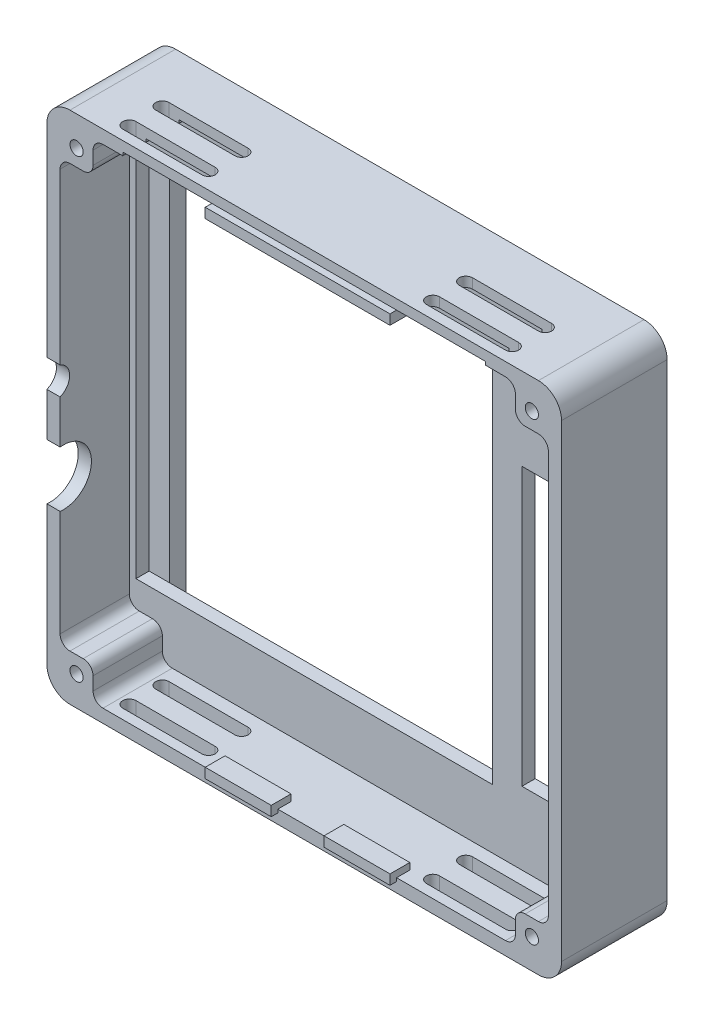
from build123d import *

# Parameters (mm, degrees)
SKETCH_1_W           = 78
SKETCH_1_H           = 78
EXTRUDE_1_DEPTH      = 5.5
SKETCH_2_W           = 78
SKETCH_2_H           = 78
EXTRUDE_2_DEPTH      = 10.5
FILLET_1_R           = 1.5
FILLET_2_R           = 3.5
CUT_EXTRUDE_1_DEPTH  = 1
CUT_EXTRUDE_2_DEPTH  = 2.5
SKETCH_5_R           = 1
CUT_EXTRUDE_3_DEPTH  = 58.15767665
SKETCH_6_W           = 55
SKETCH_6_H           = 2
SKETCH_6_W_2         = 54
SKETCH_6_H_2         = 58
SKETCH_6_W_3         = 12.5
SKETCH_6_H_3         = 42
CUT_EXTRUDE_4_DEPTH  = 57.553072419
EXTRUDE_3_DEPTH      = 1
EXTRUDE_3_DEPTH_BACK = 2
SKETCH_7_W           = 10
SKETCH_7_H           = 1.5
SKETCH_7_W_2         = 28
SKETCH_8_R           = 4.25
SKETCH_8_R_2         = 2.247220505
CUT_EXTRUDE_5_DEPTH  = 10
CUT_EXTRUDE_6_DEPTH  = 89.848185125


with BuildPart() as part:
    # 草图1 → 凸台-拉伸1 (new body)
    with BuildSketch(Plane.XY):
        Rectangle(SKETCH_1_W, SKETCH_1_H)
    extrude(amount=EXTRUDE_1_DEPTH)

    # 草图2 → 凸台-拉伸2 (add)
    with BuildSketch(Plane.XY.offset(5.5)):
        Rectangle(SKETCH_2_W, SKETCH_2_H)
        Polygon((-32, 37), (32, 37), (32, 32), (37, 32), (37, -32), (32, -32), (32, -37), (-32, -37), (-32, -32), (-37, -32), (-37, 32), (-32, 32), align=None, mode=Mode.SUBTRACT)
    extrude(amount=EXTRUDE_2_DEPTH)

    # 圆角1
    fillet_1_edges = [part.edges().sort_by_distance(p)[0] for p in [
        (37, 32, 10.75),
        (32, 32, 10.75),
        (32, 37, 10.75),
        (37, -32, 10.75),
        (32, -32, 10.75),
        (32, -37, 10.75),
        (-32, -37, 10.75),
        (-32, -32, 10.75),
        (-37, -32, 10.75),
        (-37, 32, 10.75),
        (-32, 37, 10.75),
        (-32, 32, 10.75),
    ]]
    fillet(fillet_1_edges, radius=FILLET_1_R)

    # 圆角2
    fillet_2_edges = [part.edges().sort_by_distance(p)[0] for p in [
        (-39, 39, 8),
        (39, 39, 8),
        (39, -39, 8),
        (-39, -39, 8),
    ]]
    fillet(fillet_2_edges, radius=FILLET_2_R)

    # 草图3 → 切除-拉伸1 (cut)
    with BuildSketch(Plane(origin=(0, 0, 0), x_dir=(-1, 0, 0), z_dir=(0, 0, -1))):
        with BuildLine():
            Line((37.5, -35.5), (37.5, 35.5))
            ThreePointArc((37.5, 35.5), (36.914213562, 36.914213562), (35.5, 37.5))
            Line((35.5, 37.5), (-35.5, 37.5))
            ThreePointArc((-35.5, 37.5), (-36.914213562, 36.914213562), (-37.5, 35.5))
            Line((-37.5, 35.5), (-37.5, -35.5))
            ThreePointArc((-37.5, -35.5), (-36.914213562, -36.914213562), (-35.5, -37.5))
            Line((-35.5, -37.5), (35.5, -37.5))
            ThreePointArc((35.5, -37.5), (36.914213562, -36.914213562), (37.5, -35.5))
        make_face()
    extrude(amount=-CUT_EXTRUDE_1_DEPTH, mode=Mode.SUBTRACT)

    # 草图4 → 切除-拉伸2 (cut)
    with BuildSketch(Plane(origin=(0, 0, 1), x_dir=(-1, 0, 0), z_dir=(0, 0, -1))):
        Polygon((27.5, 37.5), (-27.5, 37.5), (-27.5, 36.85), (-32.95, 36.85), (-32.95, -33), (32.95, -33), (32.95, 36.85), (27.5, 36.85), align=None)
    extrude(amount=-CUT_EXTRUDE_2_DEPTH, mode=Mode.SUBTRACT)

    # 草图5 → 切除-拉伸3 (cut, through all)
    with BuildSketch(Plane(origin=(0, 0, 1), x_dir=(-1, 0, 0), z_dir=(0, 0, -1))):
        with Locations((-34.5, 34.5)):
            Circle(SKETCH_5_R)
        with Locations((34.5, 34.5)):
            Circle(SKETCH_5_R)
        with Locations((34.5, -34.5)):
            Circle(SKETCH_5_R)
        with Locations((-34.5, -34.5)):
            Circle(SKETCH_5_R)
    extrude(amount=-CUT_EXTRUDE_3_DEPTH, mode=Mode.SUBTRACT)

    # 草图6 → 切除-拉伸4 (cut, through all)
    with BuildSketch(Plane(origin=(0, 0, 3.5), x_dir=(-1, 0, 0), z_dir=(0, 0, -1))):
        with Locations((0, 36.5)):
            Rectangle(SKETCH_6_W, SKETCH_6_H)
        with Locations((9, 1)):
            Rectangle(SKETCH_6_W_2, SKETCH_6_H_2)
        with Locations((-28.75, -5)):
            Rectangle(SKETCH_6_W_3, SKETCH_6_H_3)
    extrude(amount=-CUT_EXTRUDE_4_DEPTH, mode=Mode.SUBTRACT)

    # 草图7 → 凸台-拉伸3 (add, two sides: drawn at the far end of the back side and taken through both)
    with BuildSketch(Plane.XY.offset(16).offset(-EXTRUDE_3_DEPTH_BACK)):
        with Locations((9, -36.75)):
            Rectangle(SKETCH_7_W, SKETCH_7_H)
        with Locations((-9, -36.75)):
            Rectangle(SKETCH_7_W, SKETCH_7_H)
        with Locations((0, 36.75)):
            Rectangle(SKETCH_7_W_2, SKETCH_7_H)
    extrude(amount=EXTRUDE_3_DEPTH + EXTRUDE_3_DEPTH_BACK)

    # 草图8 → 切除-拉伸5 (cut)
    with BuildSketch(Plane(origin=(-39, 0, 0), x_dir=(0, 0, -1), z_dir=(1, 0, 0))):
        with Locations((-15.5, -10.2)):
            Circle(SKETCH_8_R)
        with Locations((-16.8, 2.7)):
            Circle(SKETCH_8_R_2)
    extrude(amount=CUT_EXTRUDE_5_DEPTH, mode=Mode.SUBTRACT)

    # 草图9 → 切除-拉伸6 (cut, through all)
    with BuildSketch(Plane.XZ.offset(39)):
        with BuildLine():
            Line((-29, 14.5), (-17, 14.5))
            ThreePointArc((-17, 14.5), (-16, 13.5), (-17, 12.5))
            Line((-17, 12.5), (-29, 12.5))
            ThreePointArc((-29, 12.5), (-30, 13.5), (-29, 14.5))
        make_face()
        with BuildLine():
            Line((-29, 9.5), (-17, 9.5))
            ThreePointArc((-17, 9.5), (-16, 8.5), (-17, 7.5))
            Line((-17, 7.5), (-29, 7.5))
            ThreePointArc((-29, 7.5), (-30, 8.5), (-29, 9.5))
        make_face()
        with BuildLine():
            Line((29, 9.5), (17, 9.5))
            ThreePointArc((17, 9.5), (16, 8.5), (17, 7.5))
            Line((17, 7.5), (29, 7.5))
            ThreePointArc((29, 7.5), (30, 8.5), (29, 9.5))
        make_face()
        with BuildLine():
            Line((29, 14.5), (17, 14.5))
            ThreePointArc((17, 14.5), (16, 13.5), (17, 12.5))
            Line((17, 12.5), (29, 12.5))
            ThreePointArc((29, 12.5), (30, 13.5), (29, 14.5))
        make_face()
    extrude(amount=-CUT_EXTRUDE_6_DEPTH, mode=Mode.SUBTRACT)


solid = part.part
